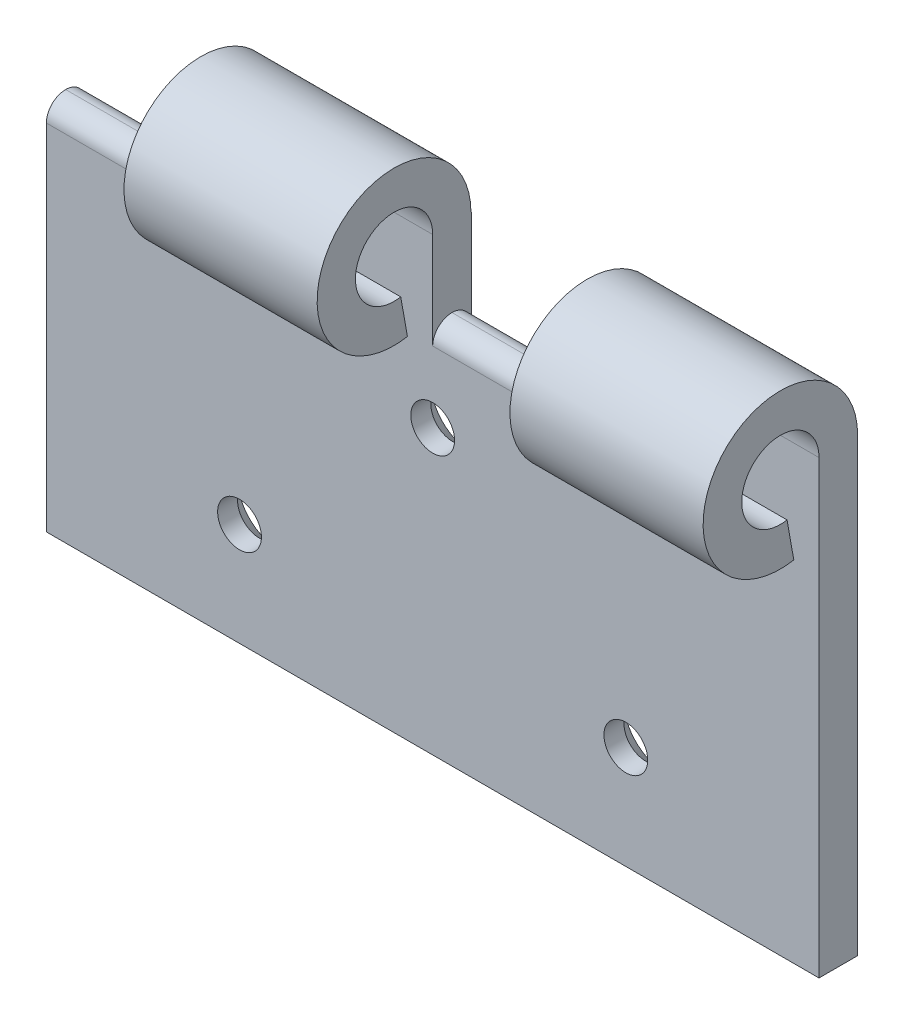
from build123d import *

# Parameters (mm, degrees)
SKETCH1_W                                           = 60
SKETCH1_H                                           = 35
BOSS_EXTRUDE1_DEPTH                                 = 3
CSK_FOR_M3_COUNTERSUNK_FLAT_HEAD_SCREW1_D           = 3.4
CSK_FOR_M3_COUNTERSUNK_FLAT_HEAD_SCREW1_DEPTH       = 3
CSK_FOR_M3_COUNTERSUNK_FLAT_HEAD_SCREW1_CSINK_D     = 6.3
CSK_FOR_M3_COUNTERSUNK_FLAT_HEAD_SCREW1_CSINK_ANGLE = 90
CSK_FOR_M3_COUNTERSUNK_FLAT_HEAD_SCREW1_TIP         = 1.021463052
BOSS_EXTRUDE2_DEPTH                                 = 15
BOSS_EXTRUDE3_DEPTH                                 = 15
CUT_EXTRUDE4_DEPTH                                  = 15
SKETCH8_W                                           = 3
SKETCH8_H                                           = 6
CUT_EXTRUDE5_DEPTH                                  = 15
FILLET4_R                                           = 1.5


with BuildPart() as part:
    # Sketch1 → Boss-Extrude1 (new body)
    with BuildSketch(Plane.XY):
        Rectangle(SKETCH1_W, SKETCH1_H)
    extrude(amount=BOSS_EXTRUDE1_DEPTH)

    # CSK for M3 Countersunk Flat Head Screw1
    with Locations(Plane(origin=(0, 0, 0), x_dir=(1, 0, 0), z_dir=(0, 0, -1))):
        with Locations((0, -4.5), (-15, 9.5), (15, 9.5)):
            CounterSinkHole(CSK_FOR_M3_COUNTERSUNK_FLAT_HEAD_SCREW1_D / 2, CSK_FOR_M3_COUNTERSUNK_FLAT_HEAD_SCREW1_CSINK_D / 2, depth=CSK_FOR_M3_COUNTERSUNK_FLAT_HEAD_SCREW1_DEPTH, counter_sink_angle=CSK_FOR_M3_COUNTERSUNK_FLAT_HEAD_SCREW1_CSINK_ANGLE)
            with Locations((0, 0, -(CSK_FOR_M3_COUNTERSUNK_FLAT_HEAD_SCREW1_DEPTH + CSK_FOR_M3_COUNTERSUNK_FLAT_HEAD_SCREW1_TIP / 2))):  # 118° drill point
                Cone(0, CSK_FOR_M3_COUNTERSUNK_FLAT_HEAD_SCREW1_D / 2, CSK_FOR_M3_COUNTERSUNK_FLAT_HEAD_SCREW1_TIP, mode=Mode.SUBTRACT)

    # Sketch5 → Boss-Extrude2 (add)
    with BuildSketch(Plane(origin=(30, 0, 0), x_dir=(0, 0, -1), z_dir=(1, 0, 0))):
        with BuildLine():
            Line((-5.479055467, 14.545576741), (-4.958110934, 11.591153482))
            ThreePointArc((-4.958110934, 11.591153482), (-8.05212086, 23.138155725), (-3, 12.303847577))
            Line((-3, 12.303847577), (-3, 17.5))
            ThreePointArc((-3, 17.5), (-8.298133329, 19.428362829), (-5.479055467, 14.545576741))
        make_face()
    extrude(amount=-BOSS_EXTRUDE2_DEPTH)

    # Sketch6 → Boss-Extrude3 (add)
    with BuildSketch(Plane.ZY):
        with BuildLine():
            Line((3, 12.335251693), (3, 17.5))
            ThreePointArc((3, 17.5), (8.298133329, 19.428362829), (5.479055467, 14.545576741))
            Line((5.479055467, 14.545576741), (4.962830018, 11.617916738))
            ThreePointArc((4.962830018, 11.617916738), (8.050201874, 23.109928462), (3, 12.335251693))
        make_face()
    extrude(amount=BOSS_EXTRUDE3_DEPTH)

    # Sketch9 → Cut-Extrude4 (cut)
    with BuildSketch(Plane.ZY.offset(15)):
        Polygon((0.004777877, 17.5), (0, 17.5), (0, 11.5), (3, 11.5), (3, 17.5), (0.027176122, 17.5), align=None)
    extrude(amount=CUT_EXTRUDE4_DEPTH, mode=Mode.SUBTRACT)

    # Sketch8 → Cut-Extrude5 (cut)
    with BuildSketch(Plane(origin=(0, 0, 0), x_dir=(0, 0, -1), z_dir=(1, 0, 0))):
        with Locations((-1.5, 14.5)):
            Rectangle(SKETCH8_W, SKETCH8_H)
    extrude(amount=CUT_EXTRUDE5_DEPTH, mode=Mode.SUBTRACT)

    # Fillet4
    fillet4_edges = [part.edges().sort_by_distance(p)[0] for p in [
        (-22.5, 11.5, 0),
        (-22.5, 11.5, 3),
        (7.5, 11.5, 0),
        (7.5, 11.5, 3),
    ]]
    fillet(fillet4_edges, radius=FILLET4_R - 0.0001)  # a hair under: the kernel refuses the full size


solid = part.part
